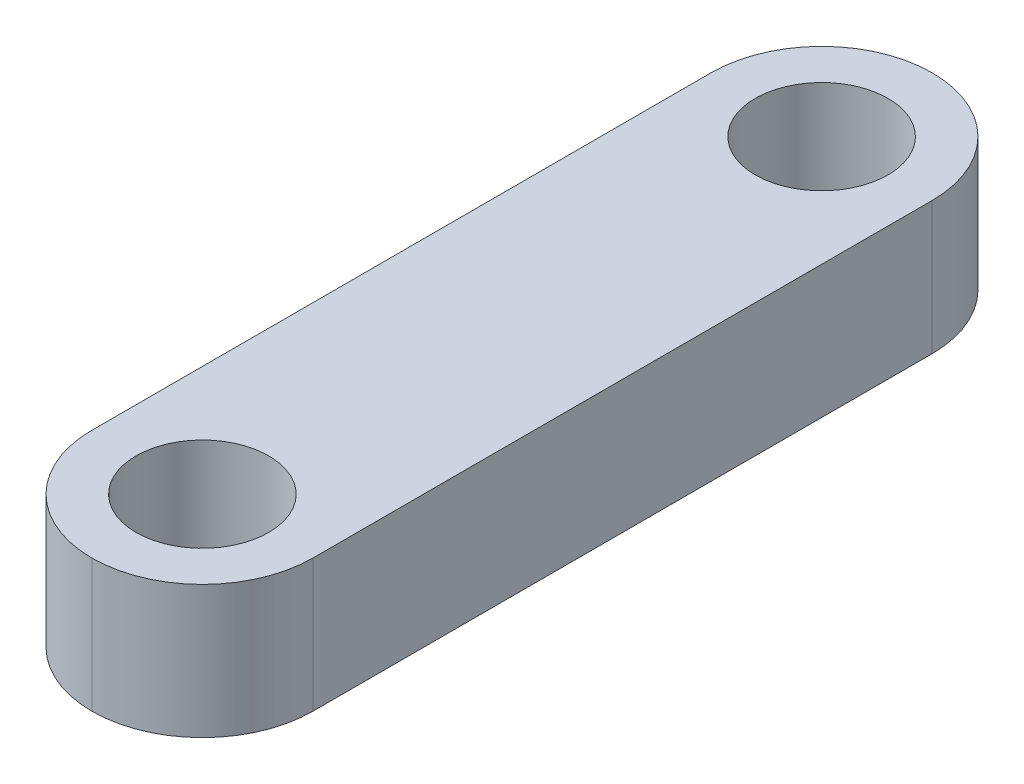
from build123d import *

# Parameters (mm, degrees)
SKETCH1_W           = 5
SKETCH1_H           = 19
SKETCH1_R           = 1.5
BOSS_EXTRUDE1_DEPTH = 3
FILLET1_R           = 2.5


with BuildPart() as part:
    # Sketch1 → Boss-Extrude1 (new body)
    with BuildSketch(Plane(origin=(0, 0, 0), x_dir=(1, 0, 0), z_dir=(0, 1, 0))):
        with Locations((0.46965829, 1.650333526)):
            Rectangle(SKETCH1_W, SKETCH1_H)
        with Locations(Location((0.46965829, -5.349666474, 0), (0, 0, 270))):
            Circle(SKETCH1_R, mode=Mode.SUBTRACT)
        with Locations(Location((0.46965829, 8.650333526, 0), (0, 0, 270))):
            Circle(SKETCH1_R, mode=Mode.SUBTRACT)
    extrude(amount=BOSS_EXTRUDE1_DEPTH)

    # Fillet1
    fillet1_edges = [part.edges().sort_by_distance(p)[0] for p in [
        (2.96965829, 1.5, -11.150333526),
        (-2.03034171, 1.5, -11.150333526),
        (2.96965829, 1.5, 7.849666474),
        (-2.03034171, 1.5, 7.849666474),
    ]]
    fillet(fillet1_edges, radius=FILLET1_R - 0.0001)  # a hair under: the kernel refuses the full size


solid = part.part
